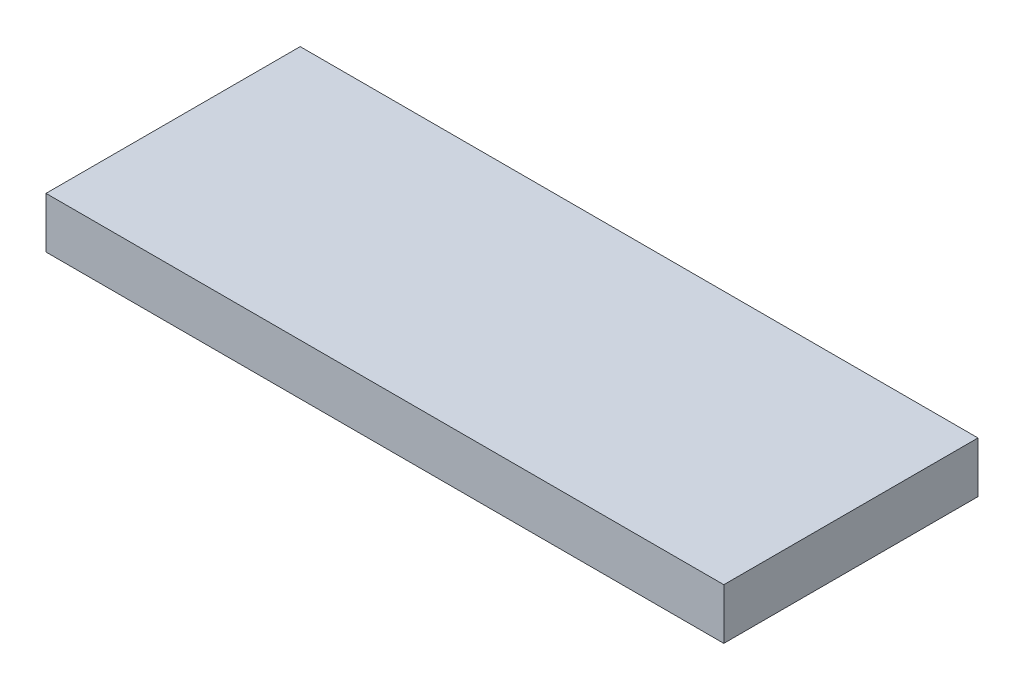
from build123d import *

# Parameters (mm, degrees)
SKETCH2_W           = 40
SKETCH2_H           = 3
BOSS_EXTRUDE2_DEPTH = 15


with BuildPart() as part:
    # Sketch2 → Boss-Extrude2 (new body)
    with BuildSketch(Plane(origin=(0, 0, 0), x_dir=(-1, 0, 0), z_dir=(0, 0, -1))):
        with Locations((0, -14.770050001)):
            Rectangle(SKETCH2_W, SKETCH2_H)
    extrude(amount=BOSS_EXTRUDE2_DEPTH)


solid = part.part
